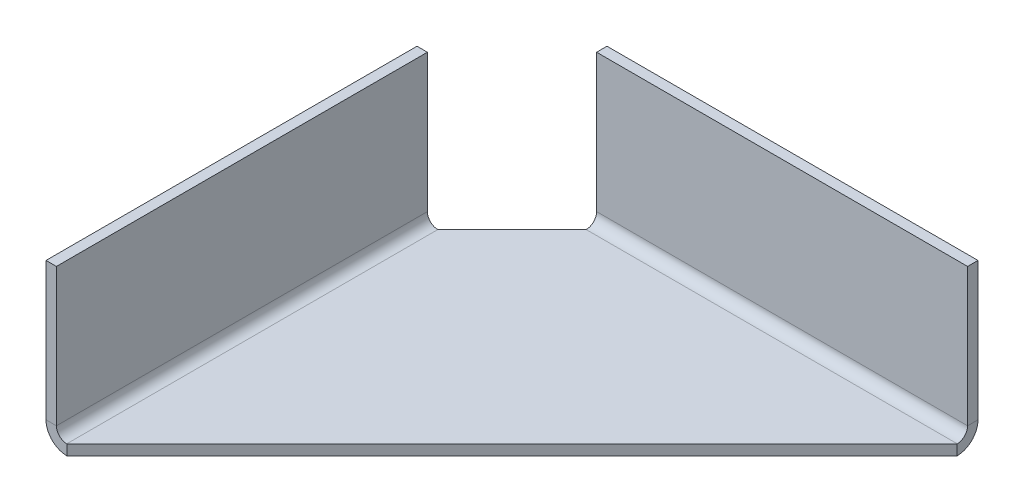
from build123d import *

# Parameters (mm, degrees)
BASE_FLANGE1_DEPTH      = 0.7
BREAK_CORNER1_OUTLINE_W = 10
BREAK_CORNER1_OUTLINE_H = 3
BREAK_CORNER1_DEPTH     = 3.535533906
EDGE_FLANGE2_DEPTH      = 25
EDGE_FLANGE2_BEND_DEPTH = 25


# Read off the part's stored shape, not the designer's step: Break-Corner1
# Sheet-metal steps are written as plain solids
with BuildPart() as part:
    # Sketch2 → Base-Flange1 (new body)
    with BuildSketch(Plane(origin=(0, 0, 0), x_dir=(1, 0, 0), z_dir=(0, 1, 0))):
        Polygon((0, 0), (0, -30), (30, 0), align=None)
    extrude(amount=-BASE_FLANGE1_DEPTH)

    # Break-Corner1 outline → Break-Corner1 (cut)
    with BuildSketch(Plane(origin=(0, 0, 0), x_dir=(0.7071067811865471, 0, -0.707106781186548), z_dir=(0.707106781186548, 0, 0.707106781186547))):
        with Locations((0, -0.5)):
            Rectangle(BREAK_CORNER1_OUTLINE_W, BREAK_CORNER1_OUTLINE_H)
    extrude(amount=BREAK_CORNER1_DEPTH, mode=Mode.SUBTRACT)

    # Edge-Flange2 section (across the edge) → Edge-Flange2 (add)
    with BuildSketch(Plane(origin=(-0.7, 0, 5), x_dir=(1, 0, 0), z_dir=(0, 0, 1))):
        with BuildLine():
            Line((-0.7, 0.7), (-0.7, 10))
            Line((-0.7, 10), (0, 10))
            Line((0, 10), (0, 0.7))
            ThreePointArc((0, 0.7), (0.205025253, 0.205025253), (0.7, 0))
            Line((0.7, 0), (0.7, -0.7))
            ThreePointArc((0.7, -0.7), (-0.289949494, -0.289949494), (-0.7, 0.7))
        make_face()
    extrude(amount=EDGE_FLANGE2_DEPTH)

    # Edge-Flange2 section 2 (across the edge) → Edge-Flange2 bend (add)
    with BuildSketch(Plane(origin=(30, 0, -0.7), x_dir=(0, 0, 1), z_dir=(-1, 0, 0))):
        with BuildLine():
            Line((-0.7, 0.7), (-0.7, 10))
            Line((-0.7, 10), (0, 10))
            Line((0, 10), (0, 0.7))
            ThreePointArc((0, 0.7), (0.205025253, 0.205025253), (0.7, 0))
            Line((0.7, 0), (0.7, -0.7))
            ThreePointArc((0.7, -0.7), (-0.289949494, -0.289949494), (-0.7, 0.7))
        make_face()
    extrude(amount=EDGE_FLANGE2_BEND_DEPTH)


solid = part.part
